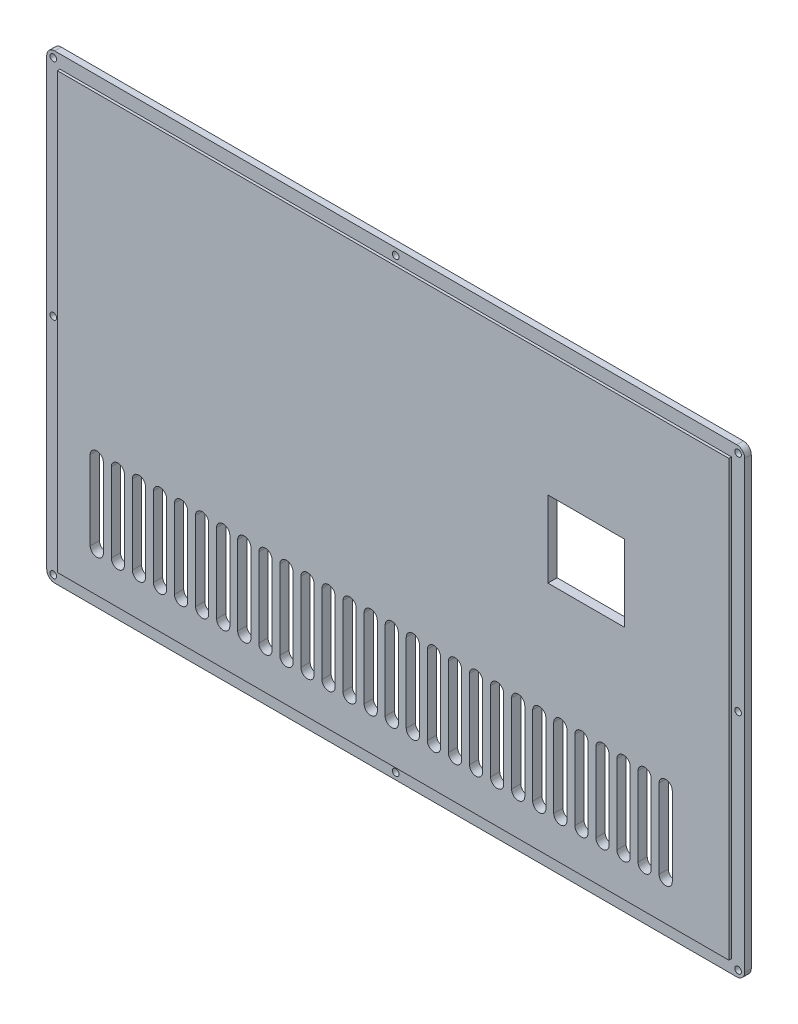
from build123d import *

# Parameters (mm, degrees)
SKETCH1_W           = 265
SKETCH1_H           = 175
BOSS_EXTRUDE1_DEPTH = 2.5
SKETCH2_W           = 255
SKETCH2_H           = 165
BOSS_EXTRUDE2_DEPTH = 1
CUT_EXTRUDE1_DEPTH  = 159.823014705
LPATTERN1_COUNT     = 28
LPATTERN1_PITCH     = 8
FILLET3_R           = 3
SKETCH5_W           = 29
SKETCH5_H           = 29
CUT_EXTRUDE3_DEPTH  = 159.823014705
BOSS_EXTRUDE3_DEPTH = 0.5
SKETCH7_R           = 1.25
CUT_EXTRUDE4_DEPTH  = 159.823014705


with BuildPart() as part:
    # Sketch1 → Boss-Extrude1 (new body)
    with BuildSketch(Plane.XY):
        Rectangle(SKETCH1_W, SKETCH1_H)
    extrude(amount=BOSS_EXTRUDE1_DEPTH)

    # Sketch2 → Boss-Extrude2 (add)
    with BuildSketch(Plane.XY.offset(2.5)):
        Rectangle(SKETCH2_W, SKETCH2_H)
    extrude(amount=BOSS_EXTRUDE2_DEPTH)

    # Sketch3 → Cut-Extrude1 (cut, through all)
    with BuildSketch(Plane(origin=(0, 0, 0), x_dir=(-1, 0, 0), z_dir=(0, 0, -1))):
        with BuildLine():
            Line((110, -67.5), (110, -37.5))
            ThreePointArc((110, -37.5), (112.5, -35), (115, -37.5))
            Line((115, -37.5), (115, -67.5))
            ThreePointArc((115, -67.5), (112.5, -70), (110, -67.5))
        make_face()
    cut_extrude1 = extrude(amount=-CUT_EXTRUDE1_DEPTH, mode=Mode.SUBTRACT)

    # LPattern1: Cut-Extrude1 ×28
    with Locations(*[(i * LPATTERN1_PITCH, 0, 0) for i in range(1, LPATTERN1_COUNT)]):
        add(cut_extrude1, mode=Mode.SUBTRACT)

    # Fillet3
    fillet3_edges = [part.edges().sort_by_distance(p)[0] for p in [
        (132.5, -87.5, 1.25),
        (132.5, 87.5, 1.25),
        (-132.5, 87.5, 1.25),
        (-132.5, -87.5, 1.25),
    ]]
    fillet(fillet3_edges, radius=FILLET3_R)

    # Sketch5 → Cut-Extrude3 (cut, through all)
    with BuildSketch(Plane(origin=(0, 0, 0), x_dir=(-1, 0, 0), z_dir=(0, 0, -1))):
        with Locations((-73.28, 21.64)):
            Rectangle(SKETCH5_W, SKETCH5_H)
    extrude(amount=-CUT_EXTRUDE3_DEPTH, mode=Mode.SUBTRACT)

    # Sketch6 → Boss-Extrude3 (add)
    # profile 1 of 6: a face of its own
    with BuildSketch(Plane(origin=(0, 0, 0), x_dir=(-1, 0, 0), z_dir=(0, 0, -1))):
        Polygon((56.833244613, 58.905517132), (86.162085152, 75.920804185), (86.162085152, 42.136452581), align=None)
        Polygon((82.36829779, 69.169212329), (64.677013544, 58.905517132), (82.36829779, 48.79034442), align=None, mode=Mode.SUBTRACT)
    # profile 2 of 6: a face of its own
    with BuildSketch(Plane(origin=(0, 0, 0), x_dir=(-1, 0, 0), z_dir=(0, 0, -1))):
        Polygon((56.726644169, 18.825025962), (86.108584626, 35.74845516), (86.108584626, 1.964103556), align=None)
    # profile 3 of 6: a face of its own
    with BuildSketch(Plane(origin=(0, 0, 0), x_dir=(-1, 0, 0), z_dir=(0, 0, -1))):
        Polygon((91.584516035, 38.911780324), (120.913484203, 55.9272906), (120.913484203, 22.142938997), align=None)
    # profile 4 of 6: a face of its own
    with BuildSketch(Plane(origin=(0, 0, 0), x_dir=(-1, 0, 0), z_dir=(0, 0, -1))):
        Polygon((89.750011934, 35.734509952), (119.079109608, 18.965594579), (89.750011934, 1.950158348), align=None)
    # profile 5 of 6: a face of its own
    with BuildSketch(Plane(origin=(0, 0, 0), x_dir=(-1, 0, 0), z_dir=(0, 0, -1))):
        Polygon((55.20239013, 55.771399116), (84.637911874, 38.941338495), (55.20239013, 21.987047512), align=None)
    # profile 6 of 6: a face of its own
    with BuildSketch(Plane(origin=(0, 0, 0), x_dir=(-1, 0, 0), z_dir=(0, 0, -1))):
        Polygon((89.759725366, 75.33593236), (119.088758287, 58.505371116), (89.759725366, 41.489823273), align=None)
    extrude(amount=BOSS_EXTRUDE3_DEPTH)

    # Sketch7 → Cut-Extrude4 (cut, through all)
    with BuildSketch(Plane(origin=(0, 0, 0), x_dir=(-1, 0, 0), z_dir=(0, 0, -1))):
        with Locations((130, -85)):
            Circle(SKETCH7_R)
        with Locations((130, 0)):
            Circle(SKETCH7_R)
        with Locations((130, 85)):
            Circle(SKETCH7_R)
        with Locations((0, 85)):
            Circle(SKETCH7_R)
        with Locations((-130, 85)):
            Circle(SKETCH7_R)
        with Locations((-130, 0)):
            Circle(SKETCH7_R)
        with Locations((-130, -85)):
            Circle(SKETCH7_R)
        with Locations((0, -85)):
            Circle(SKETCH7_R)
    extrude(amount=-CUT_EXTRUDE4_DEPTH, mode=Mode.SUBTRACT)


solid = part.part
